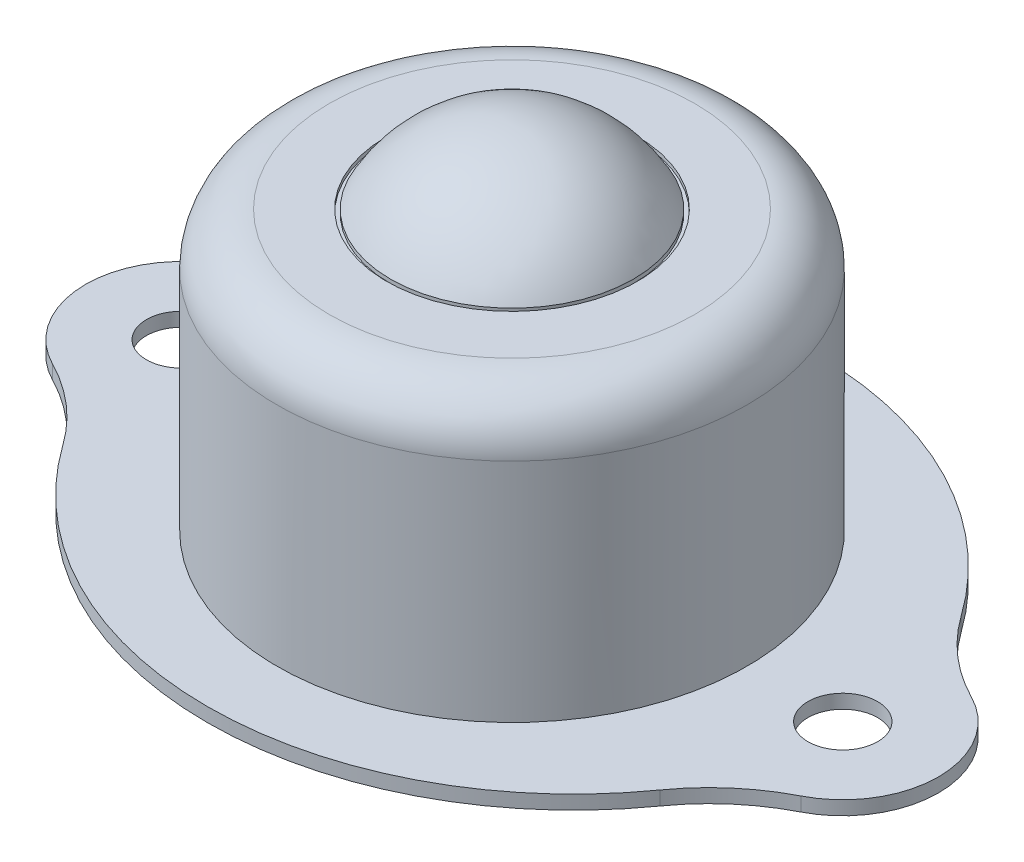
from build123d import *

# Parameters (mm, degrees)
FILLET_1_R          = 3
SKETCH_2_R          = 2
CUT_EXTRUDE_1_DEPTH = 10


with BuildPart() as part:
    # 草图1 → 旋转1 (revolve)
    with BuildSketch(Plane.XY):
        Polygon((0, -0.4), (0, 16.4), (-6.979971347, 16.4), (-6.979971347, 16.177681197), (-7.205553414, 16.177681197), (-7.205553414, 16.4), (-13.5, 16.4), (-13.5, 0.4), (-24.5, 0.4), (-24.5, -0.4), align=None)
    revolve(axis=Axis((0, 20.6, 0), (0, -1, 0)))

    # 草图1<3> → 旋转2 (revolve)
    with BuildSketch(Plane.XY):
        with BuildLine():
            Line((-6.979971347, 16.4), (0, 16.4))
            Line((0, 16.4), (0, 20.6))
            ThreePointArc((0, 20.6), (-4.073082371, 19.4690472), (-6.979971347, 16.4))
        make_face()
    revolve(axis=Axis((0, 20.6, 0), (0, -1, 0)))

    # 圆角1
    fillet_1_edges = [part.edges().sort_by_distance(p)[0] for p in [
        (13.5, 16.4, 0),
    ]]
    fillet(fillet_1_edges, radius=FILLET_1_R)

    # 草图2 → 切除-拉伸1 (cut)
    with BuildSketch(Plane.XZ.offset(0.4)):
        with Locations((-19, 0)):
            Circle(SKETCH_2_R)
        with Locations((19, 0)):
            Circle(SKETCH_2_R)
        with BuildLine():
            ThreePointArc((21.493704912, 4.90218684), (23.688569985, 2.875293288), (24.5, 0))
            ThreePointArc((24.5, 0), (0, 24.5), (-24.5, 0))
            ThreePointArc((-24.5, 0), (-23.688569985, 2.875293288), (-21.493704912, 4.90218684))
            ThreePointArc((-21.493704912, 4.90218684), (-19.095836123, 6.511883307), (-17.152006375, 8.647866302))
            ThreePointArc((-17.152006375, 8.647866302), (0, 17.502201551), (17.152006375, 8.647866302))
            ThreePointArc((17.152006375, 8.647866302), (19.095836123, 6.511883307), (21.493704912, 4.90218684))
        make_face()
        with BuildLine():
            ThreePointArc((-24.5, 0), (0, -24.5), (24.5, 0))
            ThreePointArc((24.5, 0), (23.688569985, -2.875293288), (21.493704912, -4.90218684))
            ThreePointArc((21.493704912, -4.90218684), (19.095836123, -6.511883307), (17.152006375, -8.647866302))
            ThreePointArc((17.152006375, -8.647866302), (0, -17.502201551), (-17.152006375, -8.647866302))
            ThreePointArc((-17.152006375, -8.647866302), (-19.095836123, -6.511883307), (-21.493704912, -4.90218684))
            ThreePointArc((-21.493704912, -4.90218684), (-23.688569985, -2.875293288), (-24.5, 0))
        make_face()
    extrude(amount=-CUT_EXTRUDE_1_DEPTH, mode=Mode.SUBTRACT)


solid = part.part
